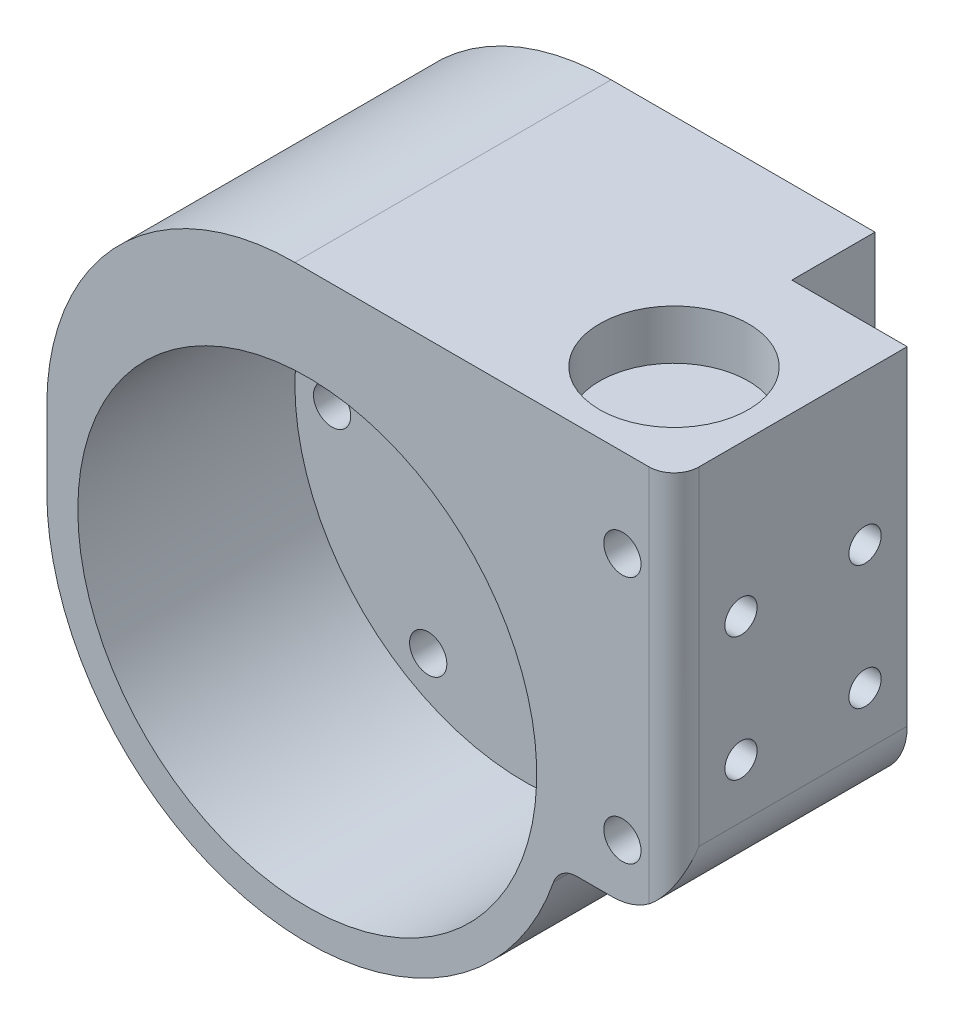
from build123d import *

# Parameters (mm, degrees)
SKETCH_1_R                = 1.5
SKETCH_1_R_2              = 6.25
EXTRUDE_1_DEPTH           = 25.5
SKETCH_2_R                = 18.5
CUT_EXTRUDE_1_DEPTH       = 17.5
SKETCH_3_W                = 9.3
SKETCH_3_H                = 31.5
CUT_EXTRUDE_2_DEPTH       = 6.7
FILLET_1_R                = 20
SKETCH_4_R                = 1.5
CUT_EXTRUDE_3_DEPTH       = 44.630787393
FILLET_3_R                = 2
FILLET_4_R                = 2
FILLET_5_R                = 5
SKETCH_5_R                = 6
CUT_EXTRUDE_4_DEPTH       = 4
SKETCH_6_R                = 1.3
CUT_EXTRUDE_5_DEPTH       = 3
MOVE_BODY_1_OUTLINE_R     = 1.5
MOVE_BODY_1_OUTLINE_R_2   = 6.25
MOVE_BODY_1_DEPTH         = 25.5
MOVE_START                = 6.7
MOVE_BODY_1_2_OUTLINE_R   = 1.5
MOVE_BODY_1_2_OUTLINE_R_2 = 18.5
MOVE_BODY_1_2_DEPTH       = 18.8
MOVE_BODY_1_3_OUTLINE_R   = 1.5
MOVE_BODY_1_3_OUTLINE_R_2 = 6.25
MOVE_BODY_1_3_DEPTH       = 8
MOVE_START_2              = -29.5669682
MOVE_BODY_1_4_OUTLINE_W   = 31.5
MOVE_BODY_1_4_OUTLINE_H   = 18.8
MOVE_BODY_1_4_DEPTH       = 9.2969682
MOVE_START_3              = -32.5669682
MOVE_BODY_1_5_OUTLINE_R   = 1.3
MOVE_BODY_1_5_DEPTH       = 3
MOVE_START_4              = -21
MOVE_BODY_1_6_DEPTH       = 47
MOVE_START_5              = 22
MOVE_BODY_1_7_OUTLINE_R   = 6
MOVE_BODY_1_7_DEPTH       = 4


with BuildPart() as part:
    # 草图1 → 凸台-拉伸1 (new body)
    with BuildSketch(Plane.XY):
        with BuildLine():
            Line((21, 0), (21, 26))
            Line((21, 26), (-29.5669682, 26))
            Line((-29.5669682, 26), (-29.5669682, -5.5))
            Line((-29.5669682, -5.5), (-20.2669682, -5.5))
            ThreePointArc((-20.2669682, -5.5), (2.774316836, -20.815935388), (21, 0))
        make_face()
        with Locations((15.5, 0)):
            Circle(SKETCH_1_R, mode=Mode.SUBTRACT)
        with Locations((-15.5, 0)):
            Circle(SKETCH_1_R, mode=Mode.SUBTRACT)
        with Locations((-7.75, 13.423393759)):
            Circle(SKETCH_1_R, mode=Mode.SUBTRACT)
        with Locations((7.75, 13.423393759)):
            Circle(SKETCH_1_R, mode=Mode.SUBTRACT)
        with Locations((7.75, -13.423393759)):
            Circle(SKETCH_1_R, mode=Mode.SUBTRACT)
        with Locations((-7.75, -13.423393759)):
            Circle(SKETCH_1_R, mode=Mode.SUBTRACT)
        with Locations((0, 7)):
            Circle(SKETCH_1_R_2, mode=Mode.SUBTRACT)
    extrude(amount=EXTRUDE_1_DEPTH)

    # 草图2 → 切除-拉伸1 (cut)
    with BuildSketch(Plane.XY.offset(25.5)):
        Circle(SKETCH_2_R)
    extrude(amount=-CUT_EXTRUDE_1_DEPTH, mode=Mode.SUBTRACT)

    # 草图3 → 切除-拉伸2 (cut)
    with BuildSketch(Plane(origin=(0, 0, 0), x_dir=(-1, 0, 0), z_dir=(0, 0, -1))):
        with Locations((24.92, 10.25)):
            Rectangle(SKETCH_3_W, SKETCH_3_H)
    extrude(amount=-CUT_EXTRUDE_2_DEPTH, mode=Mode.SUBTRACT)

    # 圆角1
    fillet_1_edges = [part.edges().sort_by_distance(p)[0] for p in [
        (21, 26, 12.75),
    ]]
    fillet(fillet_1_edges, radius=FILLET_1_R)

    # 草图4 → 切除-拉伸3 (cut, through all)
    with BuildSketch(Plane(origin=(0, 0, 6.7), x_dir=(-1, 0, 0), z_dir=(0, 0, -1))):
        with Locations((25.407304845, 18.87)):
            Circle(SKETCH_4_R)
        with Locations((25.407304845, -1.13)):
            Circle(SKETCH_4_R)
    extrude(amount=-CUT_EXTRUDE_3_DEPTH, mode=Mode.SUBTRACT)

    # 圆角3
    fillet_3_edges = [part.edges().sort_by_distance(p)[0] for p in [
        (-29.5669682, 10.25, 25.5),
    ]]
    fillet(fillet_3_edges, radius=FILLET_3_R)

    # 圆角4
    fillet_4_edges = [part.edges().sort_by_distance(p)[0] for p in [
        (-20.2669682, -5.5, 12.75),
    ]]
    fillet(fillet_4_edges, radius=FILLET_4_R)

    # 圆角5
    # the kernel refuses this fillet: 5 mm, written as the material it takes off along each edge
    with BuildSketch(Plane(origin=(-29.5669682, -5.5, -5.8), x_dir=(1, 0, 0), z_dir=(0, 0, 1))) as fillet_5_piece_1:
        with BuildLine():
            CenterArc((FILLET_5_R, FILLET_5_R), FILLET_5_R, 180, 90)
            Line((0, FILLET_5_R), (0, 0))
            Line((0, 0), (FILLET_5_R, 0))
        make_face()
    extrude(amount=41.8, mode=Mode.SUBTRACT)

    # 草图5 → 切除-拉伸4 (cut)
    with BuildSketch(Plane(origin=(0, 26, 0), x_dir=(1, 0, 0), z_dir=(0, 1, 0))):
        with Locations(Location((-21.5669682, -17.5, 0), (0, 0, 270))):
            Circle(SKETCH_5_R)
    extrude(amount=-CUT_EXTRUDE_4_DEPTH, mode=Mode.SUBTRACT)

    # 草图6 → 切除-拉伸5 (cut)
    with BuildSketch(Plane.ZY.offset(29.5669682)):
        with Locations(Location((20.1, 13.87, 0), (0, 0, 270))):
            Circle(SKETCH_6_R)
        with Locations(Location((20.1, 3.87, 0), (0, 0, 270))):
            Circle(SKETCH_6_R)
        with Locations(Location((10.1, 3.87, 0), (0, 0, 270))):
            Circle(SKETCH_6_R)
        with Locations(Location((10.1, 13.87, 0), (0, 0, 270))):
            Circle(SKETCH_6_R)
    extrude(amount=-CUT_EXTRUDE_5_DEPTH, mode=Mode.SUBTRACT)

    # Move Body 1: read off the stored shape, not the designer's step
    # Move Body 1 outline → Move Body 1 (cut)
    with BuildSketch(Plane.XY):
        with BuildLine():
            Line((1, 26), (-20.27, 26))
            Line((-20.27, 26), (-20.27, 22))
            Line((-20.27, 22), (-20.27, -6.146923411))
            ThreePointArc((-20.27, -6.146923411), (-20.024941251, -6.475836873), (-19.852135348, -6.847826087))
            ThreePointArc((-19.852135348, -6.847826087), (3.471682423, -20.711045873), (21, 0))
            Line((21, 0), (21, 6))
            ThreePointArc((21, 6), (15.142135624, 20.142135624), (1, 26))
        make_face()
        with Locations((7.75, 13.423393759)):
            Circle(MOVE_BODY_1_OUTLINE_R, mode=Mode.SUBTRACT)
        with Locations((-7.75, -13.423393759)):
            Circle(MOVE_BODY_1_OUTLINE_R, mode=Mode.SUBTRACT)
        with Locations((7.75, -13.423393759)):
            Circle(MOVE_BODY_1_OUTLINE_R, mode=Mode.SUBTRACT)
        with Locations((-15.5, 0)):
            Circle(MOVE_BODY_1_OUTLINE_R, mode=Mode.SUBTRACT)
        with Locations((15.5, 0)):
            Circle(MOVE_BODY_1_OUTLINE_R, mode=Mode.SUBTRACT)
        with Locations((-7.75, 13.423393759)):
            Circle(MOVE_BODY_1_OUTLINE_R, mode=Mode.SUBTRACT)
        with Locations((0, 7)):
            Circle(MOVE_BODY_1_OUTLINE_R_2, mode=Mode.SUBTRACT)
    extrude(amount=MOVE_BODY_1_DEPTH, mode=Mode.SUBTRACT)

    # Move Body 1 2 outline → Move Body 1 2 (add)
    with BuildSketch(Plane.XY.offset(MOVE_START)):
        with BuildLine():
            Line((-20.27, 26), (-60.133936399, 26))
            ThreePointArc((-60.133936399, 26), (-74.276072023, 20.142135624), (-80.133936399, 6))
            Line((-80.133936399, 6), (-80.133936399, 0))
            ThreePointArc((-80.133936399, 0), (-62.605618822, -20.711045873), (-39.281801051, -6.847826087))
            ThreePointArc((-39.281801051, -6.847826087), (-38.552080618, -5.871450365), (-37.391121494, -5.5))
            Line((-37.391121494, -5.5), (-34.5669682, -5.5))
            ThreePointArc((-34.5669682, -5.5), (-31.031434294, -4.035533906), (-29.5669682, -0.5))
            ThreePointArc((-29.5669682, -0.5), (-28.102502106, -4.035533905), (-24.5669682, -5.5))
            Line((-24.5669682, -5.5), (-21.742814905, -5.5))
            ThreePointArc((-21.742814905, -5.5), (-20.938499413, -5.668859211), (-20.27, -6.146923411))
            Line((-20.27, -6.146923411), (-20.27, 22))
            Line((-20.27, 22), (-20.27, 26))
        make_face()
        with Locations((-33.726631554, -1.13)):
            Circle(MOVE_BODY_1_2_OUTLINE_R, mode=Mode.SUBTRACT)
        with Locations((-25.407304845, -1.13)):
            Circle(MOVE_BODY_1_2_OUTLINE_R, mode=Mode.SUBTRACT)
        with Locations((-33.726631554, 18.87)):
            Circle(MOVE_BODY_1_2_OUTLINE_R, mode=Mode.SUBTRACT)
        with Locations((-25.407304845, 18.87)):
            Circle(MOVE_BODY_1_2_OUTLINE_R, mode=Mode.SUBTRACT)
        with Locations((-59.133936399, 0)):
            Circle(MOVE_BODY_1_2_OUTLINE_R_2, mode=Mode.SUBTRACT)
    extrude(amount=MOVE_BODY_1_2_DEPTH)

    # Move Body 1 3 outline → Move Body 1 3 (add)
    with BuildSketch(Plane.XY):
        with BuildLine():
            Line((-38.863936399, 22), (-38.863936399, 26))
            Line((-38.863936399, 26), (-60.133936399, 26))
            ThreePointArc((-60.133936399, 26), (-74.276072023, 20.142135624), (-80.133936399, 6))
            Line((-80.133936399, 6), (-80.133936399, 0))
            ThreePointArc((-80.133936399, 0), (-62.605618822, -20.711045873), (-39.281801051, -6.847826087))
            ThreePointArc((-39.281801051, -6.847826087), (-39.108995148, -6.475836873), (-38.863936399, -6.146923411))
            Line((-38.863936399, -6.146923411), (-38.863936399, 22))
        make_face()
        with Locations((-51.383936399, 13.423393759)):
            Circle(MOVE_BODY_1_3_OUTLINE_R, mode=Mode.SUBTRACT)
        with Locations((-66.883936399, -13.423393759)):
            Circle(MOVE_BODY_1_3_OUTLINE_R, mode=Mode.SUBTRACT)
        with Locations((-51.383936399, -13.423393759)):
            Circle(MOVE_BODY_1_3_OUTLINE_R, mode=Mode.SUBTRACT)
        with Locations((-74.633936399, 0)):
            Circle(MOVE_BODY_1_3_OUTLINE_R, mode=Mode.SUBTRACT)
        with Locations((-43.633936399, 0)):
            Circle(MOVE_BODY_1_3_OUTLINE_R, mode=Mode.SUBTRACT)
        with Locations((-59.133936399, 7)):
            Circle(MOVE_BODY_1_3_OUTLINE_R_2, mode=Mode.SUBTRACT)
        with Locations((-66.883936399, 13.423393759)):
            Circle(MOVE_BODY_1_3_OUTLINE_R, mode=Mode.SUBTRACT)
    extrude(amount=MOVE_BODY_1_3_DEPTH)

    # Move Body 1 4 outline → Move Body 1 4 (cut)
    with BuildSketch(Plane.YZ.offset(MOVE_START_2)):
        with Locations((10.25, 16.1)):
            Rectangle(MOVE_BODY_1_4_OUTLINE_W, MOVE_BODY_1_4_OUTLINE_H)
    extrude(amount=MOVE_BODY_1_4_DEPTH, mode=Mode.SUBTRACT)

    # Move Body 1 5 outline → Move Body 1 5 (cut)
    with BuildSketch(Plane.YZ.offset(MOVE_START_3)):
        with Locations((13.87, 20.1)):
            Circle(MOVE_BODY_1_5_OUTLINE_R)
        with Locations((3.87, 20.1)):
            Circle(MOVE_BODY_1_5_OUTLINE_R)
        with Locations((3.87, 10.1)):
            Circle(MOVE_BODY_1_5_OUTLINE_R)
        with Locations((13.87, 10.1)):
            Circle(MOVE_BODY_1_5_OUTLINE_R)
    extrude(amount=MOVE_BODY_1_5_DEPTH, mode=Mode.SUBTRACT)

    # Move Body 1 6 outline → Move Body 1 6 (cut)
    with BuildSketch(Plane(origin=(0, 0, 0), x_dir=(1, 0, 0), z_dir=(0, 1, 0)).offset(MOVE_START_4)):
        with BuildLine():
            ThreePointArc((-29.5669682, -23.5), (-30.152754638, -24.914213563), (-31.5669682, -25.5))
            Line((-31.5669682, -25.5), (-20.27, -25.5))
            Line((-20.27, -25.5), (-20.27, -6.7))
            Line((-20.27, -6.7), (-29.566968204, -6.7))
            Line((-29.566968204, -6.7), (-29.5669682, -23.5))
        make_face()
    extrude(amount=MOVE_BODY_1_6_DEPTH, mode=Mode.SUBTRACT)

    # Move Body 1 7 outline → Move Body 1 7 (cut)
    with BuildSketch(Plane(origin=(0, 0, 0), x_dir=(1, 0, 0), z_dir=(0, 1, 0)).offset(MOVE_START_5)):
        with Locations((-37.5669682, -17.5)):
            Circle(MOVE_BODY_1_7_OUTLINE_R)
    extrude(amount=MOVE_BODY_1_7_DEPTH, mode=Mode.SUBTRACT)


solid = part.part
